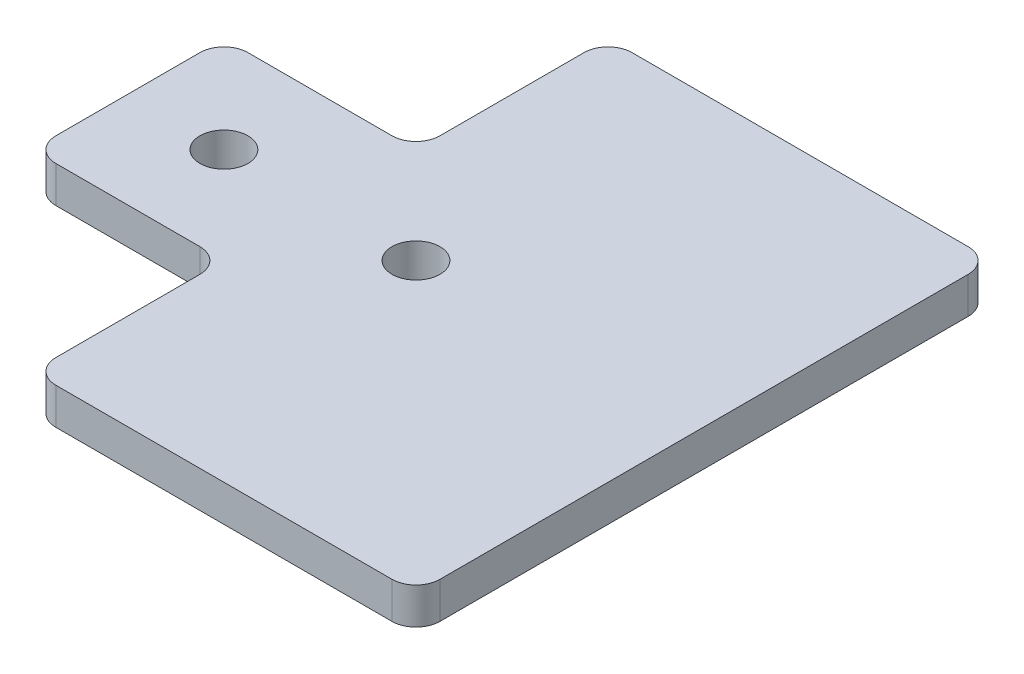
from build123d import *

# Parameters (mm, degrees)
BOSS_EXTRUDE1_DEPTH = 4.826
FILLET1_R           = 3.175
SKETCH2_R           = 3.175
CUT_EXTRUDE1_DEPTH  = 64.68312395


with BuildPart() as part:
    # Sketch1 → Boss-Extrude1 (new body)
    with BuildSketch(Plane(origin=(0, 0, 0), x_dir=(1, 0, 0), z_dir=(0, 1, 0))):
        Polygon((-25.4, 38.1), (-25.4, 12.7), (-50.8, 12.7), (-50.8, -12.7), (-25.4, -12.7), (-25.4, -38.1), (25.4, -38.1), (25.4, 38.1), align=None)
    extrude(amount=BOSS_EXTRUDE1_DEPTH)

    # Fillet1
    fillet1_edges = [part.edges().sort_by_distance(p)[0] for p in [
        (-50.8, 2.413, 12.7),
        (-50.8, 2.413, -12.7),
        (-25.4, 2.413, -12.7),
        (-25.4, 2.413, 12.7),
        (-25.4, 2.413, 38.1),
        (25.4, 2.413, 38.1),
        (25.4, 2.413, -38.1),
        (-25.4, 2.413, -38.1),
    ]]
    fillet(fillet1_edges, radius=FILLET1_R)

    # Sketch2 → Cut-Extrude1 (cut, through all)
    with BuildSketch(Plane(origin=(0, 4.826, 0), x_dir=(1, 0, 0), z_dir=(0, 1, 0))):
        with Locations((-38.1, 0)):
            Circle(SKETCH2_R)
        with Locations((-12.7, 0)):
            Circle(SKETCH2_R)
    extrude(amount=-CUT_EXTRUDE1_DEPTH, mode=Mode.SUBTRACT)


solid = part.part
